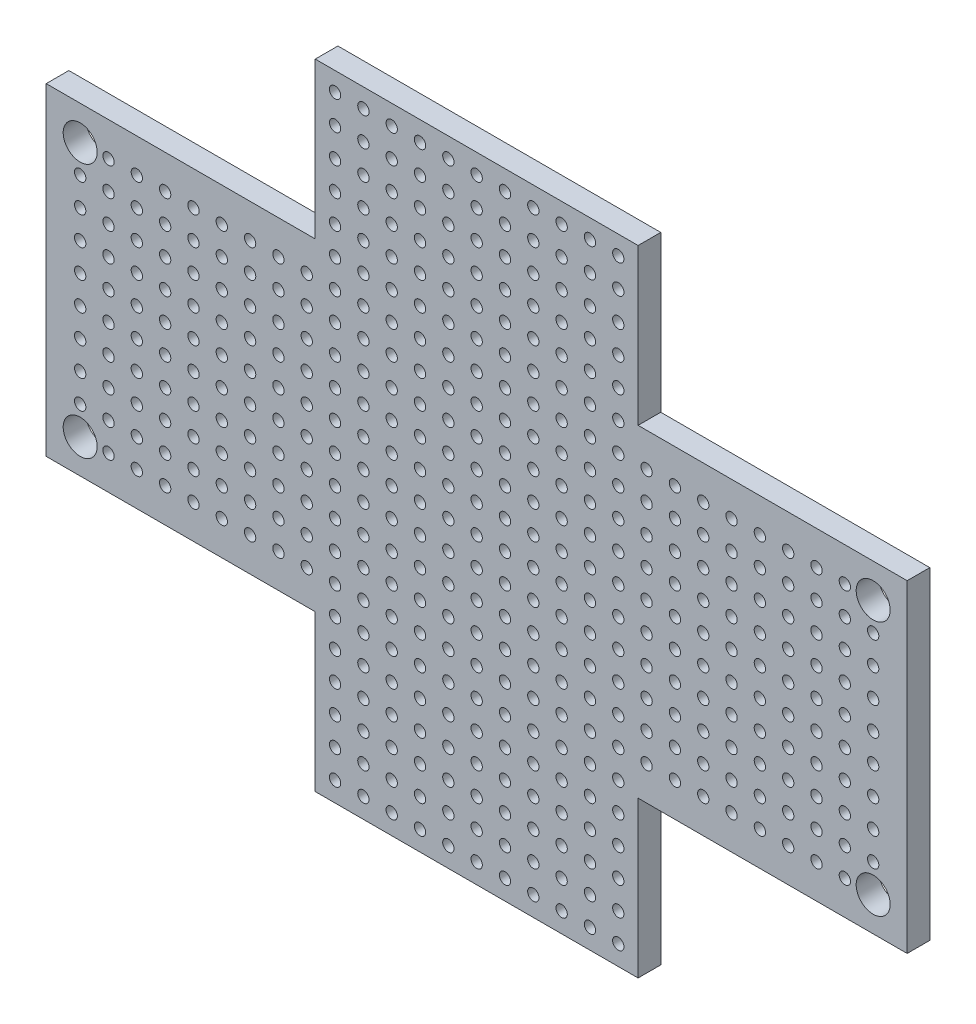
from build123d import *

# Parameters (mm, degrees)
SKETCH1_R           = 1.5
SKETCH1_R_2         = 0.5
BOSS_EXTRUDE1_DEPTH = 2


with BuildPart() as part:
    # Sketch1 → Boss-Extrude1 (new body)
    with BuildSketch(Plane.XY):
        Polygon((0, 0), (23.75, 0), (23.75, -13.75), (52.25, -13.75), (52.25, 0), (76, 0), (76, 28.5), (52.25, 28.5), (52.25, 42.25), (23.75, 42.25), (23.75, 28.5), (0, 28.5), align=None)
        with Locations((3, 25.5)):
            Circle(SKETCH1_R, mode=Mode.SUBTRACT)
        with Locations((73, 25.5)):
            Circle(SKETCH1_R, mode=Mode.SUBTRACT)
        with Locations((3, 3)):
            Circle(SKETCH1_R, mode=Mode.SUBTRACT)
        with Locations((73, 3)):
            Circle(SKETCH1_R, mode=Mode.SUBTRACT)
        with Locations((28, 38.04)):
            Circle(SKETCH1_R_2, mode=Mode.SUBTRACT)
        with Locations((5.5, 3)):
            Circle(SKETCH1_R_2, mode=Mode.SUBTRACT)
        with Locations((8, 3)):
            Circle(SKETCH1_R_2, mode=Mode.SUBTRACT)
        with Locations((10.5, 3)):
            Circle(SKETCH1_R_2, mode=Mode.SUBTRACT)
        with Locations((13, 3)):
            Circle(SKETCH1_R_2, mode=Mode.SUBTRACT)
        with Locations((15.5, 3)):
            Circle(SKETCH1_R_2, mode=Mode.SUBTRACT)
        with Locations((18, 3)):
            Circle(SKETCH1_R_2, mode=Mode.SUBTRACT)
        with Locations((20.5, 3)):
            Circle(SKETCH1_R_2, mode=Mode.SUBTRACT)
        with Locations((23, 3)):
            Circle(SKETCH1_R_2, mode=Mode.SUBTRACT)
        with Locations((25.5, 3)):
            Circle(SKETCH1_R_2, mode=Mode.SUBTRACT)
        with Locations((28, 3)):
            Circle(SKETCH1_R_2, mode=Mode.SUBTRACT)
        with Locations((30.5, 3)):
            Circle(SKETCH1_R_2, mode=Mode.SUBTRACT)
        with Locations((33, 3)):
            Circle(SKETCH1_R_2, mode=Mode.SUBTRACT)
        with Locations((35.5, 3)):
            Circle(SKETCH1_R_2, mode=Mode.SUBTRACT)
        with Locations((38, 3)):
            Circle(SKETCH1_R_2, mode=Mode.SUBTRACT)
        with Locations((40.5, 3)):
            Circle(SKETCH1_R_2, mode=Mode.SUBTRACT)
        with Locations((43, 3)):
            Circle(SKETCH1_R_2, mode=Mode.SUBTRACT)
        with Locations((45.5, 3)):
            Circle(SKETCH1_R_2, mode=Mode.SUBTRACT)
        with Locations((48, 3)):
            Circle(SKETCH1_R_2, mode=Mode.SUBTRACT)
        with Locations((50.5, 3)):
            Circle(SKETCH1_R_2, mode=Mode.SUBTRACT)
        with Locations((53, 3)):
            Circle(SKETCH1_R_2, mode=Mode.SUBTRACT)
        with Locations((55.5, 3)):
            Circle(SKETCH1_R_2, mode=Mode.SUBTRACT)
        with Locations((58, 3)):
            Circle(SKETCH1_R_2, mode=Mode.SUBTRACT)
        with Locations((60.5, 3)):
            Circle(SKETCH1_R_2, mode=Mode.SUBTRACT)
        with Locations((63, 3)):
            Circle(SKETCH1_R_2, mode=Mode.SUBTRACT)
        with Locations((65.5, 3)):
            Circle(SKETCH1_R_2, mode=Mode.SUBTRACT)
        with Locations((68, 3)):
            Circle(SKETCH1_R_2, mode=Mode.SUBTRACT)
        with Locations((70.5, 3)):
            Circle(SKETCH1_R_2, mode=Mode.SUBTRACT)
        with Locations((25.5, 38.04)):
            Circle(SKETCH1_R_2, mode=Mode.SUBTRACT)
        with Locations((5.5, 5.5)):
            Circle(SKETCH1_R_2, mode=Mode.SUBTRACT)
        with Locations((8, 5.5)):
            Circle(SKETCH1_R_2, mode=Mode.SUBTRACT)
        with Locations((10.5, 5.5)):
            Circle(SKETCH1_R_2, mode=Mode.SUBTRACT)
        with Locations((13, 5.5)):
            Circle(SKETCH1_R_2, mode=Mode.SUBTRACT)
        with Locations((15.5, 5.5)):
            Circle(SKETCH1_R_2, mode=Mode.SUBTRACT)
        with Locations((18, 5.5)):
            Circle(SKETCH1_R_2, mode=Mode.SUBTRACT)
        with Locations((20.5, 5.5)):
            Circle(SKETCH1_R_2, mode=Mode.SUBTRACT)
        with Locations((23, 5.5)):
            Circle(SKETCH1_R_2, mode=Mode.SUBTRACT)
        with Locations((25.5, 5.5)):
            Circle(SKETCH1_R_2, mode=Mode.SUBTRACT)
        with Locations((28, 5.5)):
            Circle(SKETCH1_R_2, mode=Mode.SUBTRACT)
        with Locations((30.5, 5.5)):
            Circle(SKETCH1_R_2, mode=Mode.SUBTRACT)
        with Locations((33, 5.5)):
            Circle(SKETCH1_R_2, mode=Mode.SUBTRACT)
        with Locations((35.5, 5.5)):
            Circle(SKETCH1_R_2, mode=Mode.SUBTRACT)
        with Locations((38, 5.5)):
            Circle(SKETCH1_R_2, mode=Mode.SUBTRACT)
        with Locations((40.5, 5.5)):
            Circle(SKETCH1_R_2, mode=Mode.SUBTRACT)
        with Locations((43, 5.5)):
            Circle(SKETCH1_R_2, mode=Mode.SUBTRACT)
        with Locations((45.5, 5.5)):
            Circle(SKETCH1_R_2, mode=Mode.SUBTRACT)
        with Locations((48, 5.5)):
            Circle(SKETCH1_R_2, mode=Mode.SUBTRACT)
        with Locations((50.5, 5.5)):
            Circle(SKETCH1_R_2, mode=Mode.SUBTRACT)
        with Locations((53, 5.5)):
            Circle(SKETCH1_R_2, mode=Mode.SUBTRACT)
        with Locations((55.5, 5.5)):
            Circle(SKETCH1_R_2, mode=Mode.SUBTRACT)
        with Locations((58, 5.5)):
            Circle(SKETCH1_R_2, mode=Mode.SUBTRACT)
        with Locations((60.5, 5.5)):
            Circle(SKETCH1_R_2, mode=Mode.SUBTRACT)
        with Locations((63, 5.5)):
            Circle(SKETCH1_R_2, mode=Mode.SUBTRACT)
        with Locations((65.5, 5.5)):
            Circle(SKETCH1_R_2, mode=Mode.SUBTRACT)
        with Locations((68, 5.5)):
            Circle(SKETCH1_R_2, mode=Mode.SUBTRACT)
        with Locations((70.5, 5.5)):
            Circle(SKETCH1_R_2, mode=Mode.SUBTRACT)
        with Locations((73, 5.5)):
            Circle(SKETCH1_R_2, mode=Mode.SUBTRACT)
        with Locations((5.5, 8)):
            Circle(SKETCH1_R_2, mode=Mode.SUBTRACT)
        with Locations((8, 8)):
            Circle(SKETCH1_R_2, mode=Mode.SUBTRACT)
        with Locations((10.5, 8)):
            Circle(SKETCH1_R_2, mode=Mode.SUBTRACT)
        with Locations((13, 8)):
            Circle(SKETCH1_R_2, mode=Mode.SUBTRACT)
        with Locations((15.5, 8)):
            Circle(SKETCH1_R_2, mode=Mode.SUBTRACT)
        with Locations((18, 8)):
            Circle(SKETCH1_R_2, mode=Mode.SUBTRACT)
        with Locations((20.5, 8)):
            Circle(SKETCH1_R_2, mode=Mode.SUBTRACT)
        with Locations((23, 8)):
            Circle(SKETCH1_R_2, mode=Mode.SUBTRACT)
        with Locations((25.5, 8)):
            Circle(SKETCH1_R_2, mode=Mode.SUBTRACT)
        with Locations((28, 8)):
            Circle(SKETCH1_R_2, mode=Mode.SUBTRACT)
        with Locations((30.5, 8)):
            Circle(SKETCH1_R_2, mode=Mode.SUBTRACT)
        with Locations((33, 8)):
            Circle(SKETCH1_R_2, mode=Mode.SUBTRACT)
        with Locations((35.5, 8)):
            Circle(SKETCH1_R_2, mode=Mode.SUBTRACT)
        with Locations((38, 8)):
            Circle(SKETCH1_R_2, mode=Mode.SUBTRACT)
        with Locations((40.5, 8)):
            Circle(SKETCH1_R_2, mode=Mode.SUBTRACT)
        with Locations((43, 8)):
            Circle(SKETCH1_R_2, mode=Mode.SUBTRACT)
        with Locations((45.5, 8)):
            Circle(SKETCH1_R_2, mode=Mode.SUBTRACT)
        with Locations((48, 8)):
            Circle(SKETCH1_R_2, mode=Mode.SUBTRACT)
        with Locations((50.5, 8)):
            Circle(SKETCH1_R_2, mode=Mode.SUBTRACT)
        with Locations((53, 8)):
            Circle(SKETCH1_R_2, mode=Mode.SUBTRACT)
        with Locations((55.5, 8)):
            Circle(SKETCH1_R_2, mode=Mode.SUBTRACT)
        with Locations((58, 8)):
            Circle(SKETCH1_R_2, mode=Mode.SUBTRACT)
        with Locations((60.5, 8)):
            Circle(SKETCH1_R_2, mode=Mode.SUBTRACT)
        with Locations((63, 8)):
            Circle(SKETCH1_R_2, mode=Mode.SUBTRACT)
        with Locations((65.5, 8)):
            Circle(SKETCH1_R_2, mode=Mode.SUBTRACT)
        with Locations((68, 8)):
            Circle(SKETCH1_R_2, mode=Mode.SUBTRACT)
        with Locations((70.5, 8)):
            Circle(SKETCH1_R_2, mode=Mode.SUBTRACT)
        with Locations((73, 8)):
            Circle(SKETCH1_R_2, mode=Mode.SUBTRACT)
        with Locations((5.5, 10.5)):
            Circle(SKETCH1_R_2, mode=Mode.SUBTRACT)
        with Locations((8, 10.5)):
            Circle(SKETCH1_R_2, mode=Mode.SUBTRACT)
        with Locations((10.5, 10.5)):
            Circle(SKETCH1_R_2, mode=Mode.SUBTRACT)
        with Locations((13, 10.5)):
            Circle(SKETCH1_R_2, mode=Mode.SUBTRACT)
        with Locations((15.5, 10.5)):
            Circle(SKETCH1_R_2, mode=Mode.SUBTRACT)
        with Locations((18, 10.5)):
            Circle(SKETCH1_R_2, mode=Mode.SUBTRACT)
        with Locations((20.5, 10.5)):
            Circle(SKETCH1_R_2, mode=Mode.SUBTRACT)
        with Locations((23, 10.5)):
            Circle(SKETCH1_R_2, mode=Mode.SUBTRACT)
        with Locations((25.5, 10.5)):
            Circle(SKETCH1_R_2, mode=Mode.SUBTRACT)
        with Locations((28, 10.5)):
            Circle(SKETCH1_R_2, mode=Mode.SUBTRACT)
        with Locations((30.5, 10.5)):
            Circle(SKETCH1_R_2, mode=Mode.SUBTRACT)
        with Locations((33, 10.5)):
            Circle(SKETCH1_R_2, mode=Mode.SUBTRACT)
        with Locations((35.5, 10.5)):
            Circle(SKETCH1_R_2, mode=Mode.SUBTRACT)
        with Locations((38, 10.5)):
            Circle(SKETCH1_R_2, mode=Mode.SUBTRACT)
        with Locations((40.5, 10.5)):
            Circle(SKETCH1_R_2, mode=Mode.SUBTRACT)
        with Locations((43, 10.5)):
            Circle(SKETCH1_R_2, mode=Mode.SUBTRACT)
        with Locations((45.5, 10.5)):
            Circle(SKETCH1_R_2, mode=Mode.SUBTRACT)
        with Locations((48, 10.5)):
            Circle(SKETCH1_R_2, mode=Mode.SUBTRACT)
        with Locations((50.5, 10.5)):
            Circle(SKETCH1_R_2, mode=Mode.SUBTRACT)
        with Locations((53, 10.5)):
            Circle(SKETCH1_R_2, mode=Mode.SUBTRACT)
        with Locations((55.5, 10.5)):
            Circle(SKETCH1_R_2, mode=Mode.SUBTRACT)
        with Locations((58, 10.5)):
            Circle(SKETCH1_R_2, mode=Mode.SUBTRACT)
        with Locations((60.5, 10.5)):
            Circle(SKETCH1_R_2, mode=Mode.SUBTRACT)
        with Locations((63, 10.5)):
            Circle(SKETCH1_R_2, mode=Mode.SUBTRACT)
        with Locations((65.5, 10.5)):
            Circle(SKETCH1_R_2, mode=Mode.SUBTRACT)
        with Locations((68, 10.5)):
            Circle(SKETCH1_R_2, mode=Mode.SUBTRACT)
        with Locations((70.5, 10.5)):
            Circle(SKETCH1_R_2, mode=Mode.SUBTRACT)
        with Locations((73, 10.5)):
            Circle(SKETCH1_R_2, mode=Mode.SUBTRACT)
        with Locations((5.5, 13)):
            Circle(SKETCH1_R_2, mode=Mode.SUBTRACT)
        with Locations((8, 13)):
            Circle(SKETCH1_R_2, mode=Mode.SUBTRACT)
        with Locations((10.5, 13)):
            Circle(SKETCH1_R_2, mode=Mode.SUBTRACT)
        with Locations((13, 13)):
            Circle(SKETCH1_R_2, mode=Mode.SUBTRACT)
        with Locations((15.5, 13)):
            Circle(SKETCH1_R_2, mode=Mode.SUBTRACT)
        with Locations((18, 13)):
            Circle(SKETCH1_R_2, mode=Mode.SUBTRACT)
        with Locations((20.5, 13)):
            Circle(SKETCH1_R_2, mode=Mode.SUBTRACT)
        with Locations((23, 13)):
            Circle(SKETCH1_R_2, mode=Mode.SUBTRACT)
        with Locations((25.5, 13)):
            Circle(SKETCH1_R_2, mode=Mode.SUBTRACT)
        with Locations((28, 13)):
            Circle(SKETCH1_R_2, mode=Mode.SUBTRACT)
        with Locations((30.5, 13)):
            Circle(SKETCH1_R_2, mode=Mode.SUBTRACT)
        with Locations((33, 13)):
            Circle(SKETCH1_R_2, mode=Mode.SUBTRACT)
        with Locations((35.5, 13)):
            Circle(SKETCH1_R_2, mode=Mode.SUBTRACT)
        with Locations((38, 13)):
            Circle(SKETCH1_R_2, mode=Mode.SUBTRACT)
        with Locations((40.5, 13)):
            Circle(SKETCH1_R_2, mode=Mode.SUBTRACT)
        with Locations((43, 13)):
            Circle(SKETCH1_R_2, mode=Mode.SUBTRACT)
        with Locations((45.5, 13)):
            Circle(SKETCH1_R_2, mode=Mode.SUBTRACT)
        with Locations((48, 13)):
            Circle(SKETCH1_R_2, mode=Mode.SUBTRACT)
        with Locations((50.5, 13)):
            Circle(SKETCH1_R_2, mode=Mode.SUBTRACT)
        with Locations((53, 13)):
            Circle(SKETCH1_R_2, mode=Mode.SUBTRACT)
        with Locations((55.5, 13)):
            Circle(SKETCH1_R_2, mode=Mode.SUBTRACT)
        with Locations((58, 13)):
            Circle(SKETCH1_R_2, mode=Mode.SUBTRACT)
        with Locations((60.5, 13)):
            Circle(SKETCH1_R_2, mode=Mode.SUBTRACT)
        with Locations((63, 13)):
            Circle(SKETCH1_R_2, mode=Mode.SUBTRACT)
        with Locations((65.5, 13)):
            Circle(SKETCH1_R_2, mode=Mode.SUBTRACT)
        with Locations((68, 13)):
            Circle(SKETCH1_R_2, mode=Mode.SUBTRACT)
        with Locations((70.5, 13)):
            Circle(SKETCH1_R_2, mode=Mode.SUBTRACT)
        with Locations((73, 13)):
            Circle(SKETCH1_R_2, mode=Mode.SUBTRACT)
        with Locations((5.5, 15.5)):
            Circle(SKETCH1_R_2, mode=Mode.SUBTRACT)
        with Locations((8, 15.5)):
            Circle(SKETCH1_R_2, mode=Mode.SUBTRACT)
        with Locations((10.5, 15.5)):
            Circle(SKETCH1_R_2, mode=Mode.SUBTRACT)
        with Locations((13, 15.5)):
            Circle(SKETCH1_R_2, mode=Mode.SUBTRACT)
        with Locations((15.5, 15.5)):
            Circle(SKETCH1_R_2, mode=Mode.SUBTRACT)
        with Locations((18, 15.5)):
            Circle(SKETCH1_R_2, mode=Mode.SUBTRACT)
        with Locations((20.5, 15.5)):
            Circle(SKETCH1_R_2, mode=Mode.SUBTRACT)
        with Locations((23, 15.5)):
            Circle(SKETCH1_R_2, mode=Mode.SUBTRACT)
        with Locations((25.5, 15.5)):
            Circle(SKETCH1_R_2, mode=Mode.SUBTRACT)
        with Locations((28, 15.5)):
            Circle(SKETCH1_R_2, mode=Mode.SUBTRACT)
        with Locations((30.5, 15.5)):
            Circle(SKETCH1_R_2, mode=Mode.SUBTRACT)
        with Locations((33, 15.5)):
            Circle(SKETCH1_R_2, mode=Mode.SUBTRACT)
        with Locations((35.5, 15.5)):
            Circle(SKETCH1_R_2, mode=Mode.SUBTRACT)
        with Locations((38, 15.5)):
            Circle(SKETCH1_R_2, mode=Mode.SUBTRACT)
        with Locations((40.5, 15.5)):
            Circle(SKETCH1_R_2, mode=Mode.SUBTRACT)
        with Locations((43, 15.5)):
            Circle(SKETCH1_R_2, mode=Mode.SUBTRACT)
        with Locations((45.5, 15.5)):
            Circle(SKETCH1_R_2, mode=Mode.SUBTRACT)
        with Locations((48, 15.5)):
            Circle(SKETCH1_R_2, mode=Mode.SUBTRACT)
        with Locations((50.5, 15.5)):
            Circle(SKETCH1_R_2, mode=Mode.SUBTRACT)
        with Locations((53, 15.5)):
            Circle(SKETCH1_R_2, mode=Mode.SUBTRACT)
        with Locations((55.5, 15.5)):
            Circle(SKETCH1_R_2, mode=Mode.SUBTRACT)
        with Locations((58, 15.5)):
            Circle(SKETCH1_R_2, mode=Mode.SUBTRACT)
        with Locations((60.5, 15.5)):
            Circle(SKETCH1_R_2, mode=Mode.SUBTRACT)
        with Locations((63, 15.5)):
            Circle(SKETCH1_R_2, mode=Mode.SUBTRACT)
        with Locations((65.5, 15.5)):
            Circle(SKETCH1_R_2, mode=Mode.SUBTRACT)
        with Locations((68, 15.5)):
            Circle(SKETCH1_R_2, mode=Mode.SUBTRACT)
        with Locations((70.5, 15.5)):
            Circle(SKETCH1_R_2, mode=Mode.SUBTRACT)
        with Locations((73, 15.5)):
            Circle(SKETCH1_R_2, mode=Mode.SUBTRACT)
        with Locations((5.5, 18)):
            Circle(SKETCH1_R_2, mode=Mode.SUBTRACT)
        with Locations((8, 18)):
            Circle(SKETCH1_R_2, mode=Mode.SUBTRACT)
        with Locations((10.5, 18)):
            Circle(SKETCH1_R_2, mode=Mode.SUBTRACT)
        with Locations((13, 18)):
            Circle(SKETCH1_R_2, mode=Mode.SUBTRACT)
        with Locations((15.5, 18)):
            Circle(SKETCH1_R_2, mode=Mode.SUBTRACT)
        with Locations((18, 18)):
            Circle(SKETCH1_R_2, mode=Mode.SUBTRACT)
        with Locations((20.5, 18)):
            Circle(SKETCH1_R_2, mode=Mode.SUBTRACT)
        with Locations((23, 18)):
            Circle(SKETCH1_R_2, mode=Mode.SUBTRACT)
        with Locations((25.5, 18)):
            Circle(SKETCH1_R_2, mode=Mode.SUBTRACT)
        with Locations((28, 18)):
            Circle(SKETCH1_R_2, mode=Mode.SUBTRACT)
        with Locations((30.5, 18)):
            Circle(SKETCH1_R_2, mode=Mode.SUBTRACT)
        with Locations((33, 18)):
            Circle(SKETCH1_R_2, mode=Mode.SUBTRACT)
        with Locations((35.5, 18)):
            Circle(SKETCH1_R_2, mode=Mode.SUBTRACT)
        with Locations((38, 18)):
            Circle(SKETCH1_R_2, mode=Mode.SUBTRACT)
        with Locations((40.5, 18)):
            Circle(SKETCH1_R_2, mode=Mode.SUBTRACT)
        with Locations((43, 18)):
            Circle(SKETCH1_R_2, mode=Mode.SUBTRACT)
        with Locations((45.5, 18)):
            Circle(SKETCH1_R_2, mode=Mode.SUBTRACT)
        with Locations((48, 18)):
            Circle(SKETCH1_R_2, mode=Mode.SUBTRACT)
        with Locations((50.5, 18)):
            Circle(SKETCH1_R_2, mode=Mode.SUBTRACT)
        with Locations((53, 18)):
            Circle(SKETCH1_R_2, mode=Mode.SUBTRACT)
        with Locations((55.5, 18)):
            Circle(SKETCH1_R_2, mode=Mode.SUBTRACT)
        with Locations((58, 18)):
            Circle(SKETCH1_R_2, mode=Mode.SUBTRACT)
        with Locations((60.5, 18)):
            Circle(SKETCH1_R_2, mode=Mode.SUBTRACT)
        with Locations((63, 18)):
            Circle(SKETCH1_R_2, mode=Mode.SUBTRACT)
        with Locations((65.5, 18)):
            Circle(SKETCH1_R_2, mode=Mode.SUBTRACT)
        with Locations((68, 18)):
            Circle(SKETCH1_R_2, mode=Mode.SUBTRACT)
        with Locations((70.5, 18)):
            Circle(SKETCH1_R_2, mode=Mode.SUBTRACT)
        with Locations((73, 18)):
            Circle(SKETCH1_R_2, mode=Mode.SUBTRACT)
        with Locations((5.5, 20.5)):
            Circle(SKETCH1_R_2, mode=Mode.SUBTRACT)
        with Locations((8, 20.5)):
            Circle(SKETCH1_R_2, mode=Mode.SUBTRACT)
        with Locations((10.5, 20.5)):
            Circle(SKETCH1_R_2, mode=Mode.SUBTRACT)
        with Locations((13, 20.5)):
            Circle(SKETCH1_R_2, mode=Mode.SUBTRACT)
        with Locations((15.5, 20.5)):
            Circle(SKETCH1_R_2, mode=Mode.SUBTRACT)
        with Locations((18, 20.5)):
            Circle(SKETCH1_R_2, mode=Mode.SUBTRACT)
        with Locations((20.5, 20.5)):
            Circle(SKETCH1_R_2, mode=Mode.SUBTRACT)
        with Locations((23, 20.5)):
            Circle(SKETCH1_R_2, mode=Mode.SUBTRACT)
        with Locations((25.5, 20.5)):
            Circle(SKETCH1_R_2, mode=Mode.SUBTRACT)
        with Locations((28, 20.5)):
            Circle(SKETCH1_R_2, mode=Mode.SUBTRACT)
        with Locations((30.5, 20.5)):
            Circle(SKETCH1_R_2, mode=Mode.SUBTRACT)
        with Locations((33, 20.5)):
            Circle(SKETCH1_R_2, mode=Mode.SUBTRACT)
        with Locations((35.5, 20.5)):
            Circle(SKETCH1_R_2, mode=Mode.SUBTRACT)
        with Locations((38, 20.5)):
            Circle(SKETCH1_R_2, mode=Mode.SUBTRACT)
        with Locations((40.5, 20.5)):
            Circle(SKETCH1_R_2, mode=Mode.SUBTRACT)
        with Locations((43, 20.5)):
            Circle(SKETCH1_R_2, mode=Mode.SUBTRACT)
        with Locations((45.5, 20.5)):
            Circle(SKETCH1_R_2, mode=Mode.SUBTRACT)
        with Locations((48, 20.5)):
            Circle(SKETCH1_R_2, mode=Mode.SUBTRACT)
        with Locations((50.5, 20.5)):
            Circle(SKETCH1_R_2, mode=Mode.SUBTRACT)
        with Locations((53, 20.5)):
            Circle(SKETCH1_R_2, mode=Mode.SUBTRACT)
        with Locations((55.5, 20.5)):
            Circle(SKETCH1_R_2, mode=Mode.SUBTRACT)
        with Locations((58, 20.5)):
            Circle(SKETCH1_R_2, mode=Mode.SUBTRACT)
        with Locations((60.5, 20.5)):
            Circle(SKETCH1_R_2, mode=Mode.SUBTRACT)
        with Locations((63, 20.5)):
            Circle(SKETCH1_R_2, mode=Mode.SUBTRACT)
        with Locations((65.5, 20.5)):
            Circle(SKETCH1_R_2, mode=Mode.SUBTRACT)
        with Locations((68, 20.5)):
            Circle(SKETCH1_R_2, mode=Mode.SUBTRACT)
        with Locations((70.5, 20.5)):
            Circle(SKETCH1_R_2, mode=Mode.SUBTRACT)
        with Locations((73, 20.5)):
            Circle(SKETCH1_R_2, mode=Mode.SUBTRACT)
        with Locations((5.5, 23)):
            Circle(SKETCH1_R_2, mode=Mode.SUBTRACT)
        with Locations((8, 23)):
            Circle(SKETCH1_R_2, mode=Mode.SUBTRACT)
        with Locations((10.5, 23)):
            Circle(SKETCH1_R_2, mode=Mode.SUBTRACT)
        with Locations((13, 23)):
            Circle(SKETCH1_R_2, mode=Mode.SUBTRACT)
        with Locations((15.5, 23)):
            Circle(SKETCH1_R_2, mode=Mode.SUBTRACT)
        with Locations((18, 23)):
            Circle(SKETCH1_R_2, mode=Mode.SUBTRACT)
        with Locations((20.5, 23)):
            Circle(SKETCH1_R_2, mode=Mode.SUBTRACT)
        with Locations((23, 23)):
            Circle(SKETCH1_R_2, mode=Mode.SUBTRACT)
        with Locations((25.5, 23)):
            Circle(SKETCH1_R_2, mode=Mode.SUBTRACT)
        with Locations((28, 23)):
            Circle(SKETCH1_R_2, mode=Mode.SUBTRACT)
        with Locations((30.5, 23)):
            Circle(SKETCH1_R_2, mode=Mode.SUBTRACT)
        with Locations((33, 23)):
            Circle(SKETCH1_R_2, mode=Mode.SUBTRACT)
        with Locations((35.5, 23)):
            Circle(SKETCH1_R_2, mode=Mode.SUBTRACT)
        with Locations((38, 23)):
            Circle(SKETCH1_R_2, mode=Mode.SUBTRACT)
        with Locations((40.5, 23)):
            Circle(SKETCH1_R_2, mode=Mode.SUBTRACT)
        with Locations((43, 23)):
            Circle(SKETCH1_R_2, mode=Mode.SUBTRACT)
        with Locations((45.5, 23)):
            Circle(SKETCH1_R_2, mode=Mode.SUBTRACT)
        with Locations((48, 23)):
            Circle(SKETCH1_R_2, mode=Mode.SUBTRACT)
        with Locations((50.5, 23)):
            Circle(SKETCH1_R_2, mode=Mode.SUBTRACT)
        with Locations((53, 23)):
            Circle(SKETCH1_R_2, mode=Mode.SUBTRACT)
        with Locations((55.5, 23)):
            Circle(SKETCH1_R_2, mode=Mode.SUBTRACT)
        with Locations((58, 23)):
            Circle(SKETCH1_R_2, mode=Mode.SUBTRACT)
        with Locations((60.5, 23)):
            Circle(SKETCH1_R_2, mode=Mode.SUBTRACT)
        with Locations((63, 23)):
            Circle(SKETCH1_R_2, mode=Mode.SUBTRACT)
        with Locations((65.5, 23)):
            Circle(SKETCH1_R_2, mode=Mode.SUBTRACT)
        with Locations((68, 23)):
            Circle(SKETCH1_R_2, mode=Mode.SUBTRACT)
        with Locations((70.5, 23)):
            Circle(SKETCH1_R_2, mode=Mode.SUBTRACT)
        with Locations((73, 23)):
            Circle(SKETCH1_R_2, mode=Mode.SUBTRACT)
        with Locations((5.5, 25.5)):
            Circle(SKETCH1_R_2, mode=Mode.SUBTRACT)
        with Locations((8, 25.5)):
            Circle(SKETCH1_R_2, mode=Mode.SUBTRACT)
        with Locations((10.5, 25.5)):
            Circle(SKETCH1_R_2, mode=Mode.SUBTRACT)
        with Locations((13, 25.5)):
            Circle(SKETCH1_R_2, mode=Mode.SUBTRACT)
        with Locations((15.5, 25.5)):
            Circle(SKETCH1_R_2, mode=Mode.SUBTRACT)
        with Locations((18, 25.5)):
            Circle(SKETCH1_R_2, mode=Mode.SUBTRACT)
        with Locations((20.5, 25.5)):
            Circle(SKETCH1_R_2, mode=Mode.SUBTRACT)
        with Locations((23, 25.5)):
            Circle(SKETCH1_R_2, mode=Mode.SUBTRACT)
        with Locations((25.5, 25.5)):
            Circle(SKETCH1_R_2, mode=Mode.SUBTRACT)
        with Locations((28, 25.5)):
            Circle(SKETCH1_R_2, mode=Mode.SUBTRACT)
        with Locations((30.5, 25.5)):
            Circle(SKETCH1_R_2, mode=Mode.SUBTRACT)
        with Locations((33, 25.5)):
            Circle(SKETCH1_R_2, mode=Mode.SUBTRACT)
        with Locations((35.5, 25.5)):
            Circle(SKETCH1_R_2, mode=Mode.SUBTRACT)
        with Locations((38, 25.5)):
            Circle(SKETCH1_R_2, mode=Mode.SUBTRACT)
        with Locations((40.5, 25.5)):
            Circle(SKETCH1_R_2, mode=Mode.SUBTRACT)
        with Locations((43, 25.5)):
            Circle(SKETCH1_R_2, mode=Mode.SUBTRACT)
        with Locations((45.5, 25.5)):
            Circle(SKETCH1_R_2, mode=Mode.SUBTRACT)
        with Locations((48, 25.5)):
            Circle(SKETCH1_R_2, mode=Mode.SUBTRACT)
        with Locations((50.5, 25.5)):
            Circle(SKETCH1_R_2, mode=Mode.SUBTRACT)
        with Locations((53, 25.5)):
            Circle(SKETCH1_R_2, mode=Mode.SUBTRACT)
        with Locations((55.5, 25.5)):
            Circle(SKETCH1_R_2, mode=Mode.SUBTRACT)
        with Locations((58, 25.5)):
            Circle(SKETCH1_R_2, mode=Mode.SUBTRACT)
        with Locations((60.5, 25.5)):
            Circle(SKETCH1_R_2, mode=Mode.SUBTRACT)
        with Locations((63, 25.5)):
            Circle(SKETCH1_R_2, mode=Mode.SUBTRACT)
        with Locations((65.5, 25.5)):
            Circle(SKETCH1_R_2, mode=Mode.SUBTRACT)
        with Locations((68, 25.5)):
            Circle(SKETCH1_R_2, mode=Mode.SUBTRACT)
        with Locations((70.5, 25.5)):
            Circle(SKETCH1_R_2, mode=Mode.SUBTRACT)
        with Locations((28, 40.58)):
            Circle(SKETCH1_R_2, mode=Mode.SUBTRACT)
        with Locations((3, 5.5)):
            Circle(SKETCH1_R_2, mode=Mode.SUBTRACT)
        with Locations((3, 8)):
            Circle(SKETCH1_R_2, mode=Mode.SUBTRACT)
        with Locations((3, 10.5)):
            Circle(SKETCH1_R_2, mode=Mode.SUBTRACT)
        with Locations((3, 13)):
            Circle(SKETCH1_R_2, mode=Mode.SUBTRACT)
        with Locations((3, 15.5)):
            Circle(SKETCH1_R_2, mode=Mode.SUBTRACT)
        with Locations((3, 18)):
            Circle(SKETCH1_R_2, mode=Mode.SUBTRACT)
        with Locations((3, 20.5)):
            Circle(SKETCH1_R_2, mode=Mode.SUBTRACT)
        with Locations((3, 23)):
            Circle(SKETCH1_R_2, mode=Mode.SUBTRACT)
        with Locations((25.5, 40.58)):
            Circle(SKETCH1_R_2, mode=Mode.SUBTRACT)
        with Locations((25.5, 28)):
            Circle(SKETCH1_R_2, mode=Mode.SUBTRACT)
        with Locations((28, 28)):
            Circle(SKETCH1_R_2, mode=Mode.SUBTRACT)
        with Locations((30.5, 28)):
            Circle(SKETCH1_R_2, mode=Mode.SUBTRACT)
        with Locations((33, 28)):
            Circle(SKETCH1_R_2, mode=Mode.SUBTRACT)
        with Locations((35.5, 28)):
            Circle(SKETCH1_R_2, mode=Mode.SUBTRACT)
        with Locations((38, 28)):
            Circle(SKETCH1_R_2, mode=Mode.SUBTRACT)
        with Locations((40.5, 28)):
            Circle(SKETCH1_R_2, mode=Mode.SUBTRACT)
        with Locations((43, 28)):
            Circle(SKETCH1_R_2, mode=Mode.SUBTRACT)
        with Locations((45.5, 28)):
            Circle(SKETCH1_R_2, mode=Mode.SUBTRACT)
        with Locations((48, 28)):
            Circle(SKETCH1_R_2, mode=Mode.SUBTRACT)
        with Locations((50.5, 28)):
            Circle(SKETCH1_R_2, mode=Mode.SUBTRACT)
        with Locations((25.5, 30.5)):
            Circle(SKETCH1_R_2, mode=Mode.SUBTRACT)
        with Locations((28, 30.5)):
            Circle(SKETCH1_R_2, mode=Mode.SUBTRACT)
        with Locations((30.5, 30.5)):
            Circle(SKETCH1_R_2, mode=Mode.SUBTRACT)
        with Locations((33, 30.5)):
            Circle(SKETCH1_R_2, mode=Mode.SUBTRACT)
        with Locations((35.5, 30.5)):
            Circle(SKETCH1_R_2, mode=Mode.SUBTRACT)
        with Locations((38, 30.5)):
            Circle(SKETCH1_R_2, mode=Mode.SUBTRACT)
        with Locations((40.5, 30.5)):
            Circle(SKETCH1_R_2, mode=Mode.SUBTRACT)
        with Locations((43, 30.5)):
            Circle(SKETCH1_R_2, mode=Mode.SUBTRACT)
        with Locations((45.5, 30.5)):
            Circle(SKETCH1_R_2, mode=Mode.SUBTRACT)
        with Locations((48, 30.5)):
            Circle(SKETCH1_R_2, mode=Mode.SUBTRACT)
        with Locations((50.5, 30.5)):
            Circle(SKETCH1_R_2, mode=Mode.SUBTRACT)
        with Locations((25.5, 33)):
            Circle(SKETCH1_R_2, mode=Mode.SUBTRACT)
        with Locations((28, 33)):
            Circle(SKETCH1_R_2, mode=Mode.SUBTRACT)
        with Locations((30.5, 33)):
            Circle(SKETCH1_R_2, mode=Mode.SUBTRACT)
        with Locations((33, 33)):
            Circle(SKETCH1_R_2, mode=Mode.SUBTRACT)
        with Locations((35.5, 33)):
            Circle(SKETCH1_R_2, mode=Mode.SUBTRACT)
        with Locations((38, 33)):
            Circle(SKETCH1_R_2, mode=Mode.SUBTRACT)
        with Locations((40.5, 33)):
            Circle(SKETCH1_R_2, mode=Mode.SUBTRACT)
        with Locations((43, 33)):
            Circle(SKETCH1_R_2, mode=Mode.SUBTRACT)
        with Locations((45.5, 33)):
            Circle(SKETCH1_R_2, mode=Mode.SUBTRACT)
        with Locations((48, 33)):
            Circle(SKETCH1_R_2, mode=Mode.SUBTRACT)
        with Locations((50.5, 33)):
            Circle(SKETCH1_R_2, mode=Mode.SUBTRACT)
        with Locations((25.5, 35.5)):
            Circle(SKETCH1_R_2, mode=Mode.SUBTRACT)
        with Locations((28, 35.5)):
            Circle(SKETCH1_R_2, mode=Mode.SUBTRACT)
        with Locations((30.5, 35.5)):
            Circle(SKETCH1_R_2, mode=Mode.SUBTRACT)
        with Locations((33, 35.5)):
            Circle(SKETCH1_R_2, mode=Mode.SUBTRACT)
        with Locations((35.5, 35.5)):
            Circle(SKETCH1_R_2, mode=Mode.SUBTRACT)
        with Locations((38, 35.5)):
            Circle(SKETCH1_R_2, mode=Mode.SUBTRACT)
        with Locations((40.5, 35.5)):
            Circle(SKETCH1_R_2, mode=Mode.SUBTRACT)
        with Locations((43, 35.5)):
            Circle(SKETCH1_R_2, mode=Mode.SUBTRACT)
        with Locations((45.5, 35.5)):
            Circle(SKETCH1_R_2, mode=Mode.SUBTRACT)
        with Locations((48, 35.5)):
            Circle(SKETCH1_R_2, mode=Mode.SUBTRACT)
        with Locations((50.5, 35.5)):
            Circle(SKETCH1_R_2, mode=Mode.SUBTRACT)
        with Locations((50.5, 38.04)):
            Circle(SKETCH1_R_2, mode=Mode.SUBTRACT)
        with Locations((48, 38.04)):
            Circle(SKETCH1_R_2, mode=Mode.SUBTRACT)
        with Locations((30.5, 38)):
            Circle(SKETCH1_R_2, mode=Mode.SUBTRACT)
        with Locations((33, 38)):
            Circle(SKETCH1_R_2, mode=Mode.SUBTRACT)
        with Locations((35.5, 38)):
            Circle(SKETCH1_R_2, mode=Mode.SUBTRACT)
        with Locations((38, 38)):
            Circle(SKETCH1_R_2, mode=Mode.SUBTRACT)
        with Locations((40.5, 38)):
            Circle(SKETCH1_R_2, mode=Mode.SUBTRACT)
        with Locations((43, 38)):
            Circle(SKETCH1_R_2, mode=Mode.SUBTRACT)
        with Locations((45.5, 38)):
            Circle(SKETCH1_R_2, mode=Mode.SUBTRACT)
        with Locations((50.5, 40.58)):
            Circle(SKETCH1_R_2, mode=Mode.SUBTRACT)
        with Locations((48, 40.58)):
            Circle(SKETCH1_R_2, mode=Mode.SUBTRACT)
        with Locations((30.5, 40.5)):
            Circle(SKETCH1_R_2, mode=Mode.SUBTRACT)
        with Locations((33, 40.5)):
            Circle(SKETCH1_R_2, mode=Mode.SUBTRACT)
        with Locations((35.5, 40.5)):
            Circle(SKETCH1_R_2, mode=Mode.SUBTRACT)
        with Locations((38, 40.5)):
            Circle(SKETCH1_R_2, mode=Mode.SUBTRACT)
        with Locations((40.5, 40.5)):
            Circle(SKETCH1_R_2, mode=Mode.SUBTRACT)
        with Locations((43, 40.5)):
            Circle(SKETCH1_R_2, mode=Mode.SUBTRACT)
        with Locations((45.5, 40.5)):
            Circle(SKETCH1_R_2, mode=Mode.SUBTRACT)
        with Locations((25.5, -12)):
            Circle(SKETCH1_R_2, mode=Mode.SUBTRACT)
        with Locations((25.5, -9.5)):
            Circle(SKETCH1_R_2, mode=Mode.SUBTRACT)
        with Locations((25.5, -7)):
            Circle(SKETCH1_R_2, mode=Mode.SUBTRACT)
        with Locations((25.5, -4.5)):
            Circle(SKETCH1_R_2, mode=Mode.SUBTRACT)
        with Locations((25.5, -2)):
            Circle(SKETCH1_R_2, mode=Mode.SUBTRACT)
        with Locations((25.5, 0.5)):
            Circle(SKETCH1_R_2, mode=Mode.SUBTRACT)
        with Locations((50.5, -12)):
            Circle(SKETCH1_R_2, mode=Mode.SUBTRACT)
        with Locations((48, -12)):
            Circle(SKETCH1_R_2, mode=Mode.SUBTRACT)
        with Locations((45.5, -12)):
            Circle(SKETCH1_R_2, mode=Mode.SUBTRACT)
        with Locations((43, -12)):
            Circle(SKETCH1_R_2, mode=Mode.SUBTRACT)
        with Locations((40.5, -12)):
            Circle(SKETCH1_R_2, mode=Mode.SUBTRACT)
        with Locations((38, -12)):
            Circle(SKETCH1_R_2, mode=Mode.SUBTRACT)
        with Locations((35.5, -12)):
            Circle(SKETCH1_R_2, mode=Mode.SUBTRACT)
        with Locations((33, -12)):
            Circle(SKETCH1_R_2, mode=Mode.SUBTRACT)
        with Locations((30.5, -12)):
            Circle(SKETCH1_R_2, mode=Mode.SUBTRACT)
        with Locations((28, -12)):
            Circle(SKETCH1_R_2, mode=Mode.SUBTRACT)
        with Locations((50.5, -9.5)):
            Circle(SKETCH1_R_2, mode=Mode.SUBTRACT)
        with Locations((48, -9.5)):
            Circle(SKETCH1_R_2, mode=Mode.SUBTRACT)
        with Locations((45.5, -9.5)):
            Circle(SKETCH1_R_2, mode=Mode.SUBTRACT)
        with Locations((43, -9.5)):
            Circle(SKETCH1_R_2, mode=Mode.SUBTRACT)
        with Locations((40.5, -9.5)):
            Circle(SKETCH1_R_2, mode=Mode.SUBTRACT)
        with Locations((38, -9.5)):
            Circle(SKETCH1_R_2, mode=Mode.SUBTRACT)
        with Locations((35.5, -9.5)):
            Circle(SKETCH1_R_2, mode=Mode.SUBTRACT)
        with Locations((33, -9.5)):
            Circle(SKETCH1_R_2, mode=Mode.SUBTRACT)
        with Locations((30.5, -9.5)):
            Circle(SKETCH1_R_2, mode=Mode.SUBTRACT)
        with Locations((28, -9.5)):
            Circle(SKETCH1_R_2, mode=Mode.SUBTRACT)
        with Locations((50.5, -7)):
            Circle(SKETCH1_R_2, mode=Mode.SUBTRACT)
        with Locations((48, -7)):
            Circle(SKETCH1_R_2, mode=Mode.SUBTRACT)
        with Locations((45.5, -7)):
            Circle(SKETCH1_R_2, mode=Mode.SUBTRACT)
        with Locations((43, -7)):
            Circle(SKETCH1_R_2, mode=Mode.SUBTRACT)
        with Locations((40.5, -7)):
            Circle(SKETCH1_R_2, mode=Mode.SUBTRACT)
        with Locations((38, -7)):
            Circle(SKETCH1_R_2, mode=Mode.SUBTRACT)
        with Locations((35.5, -7)):
            Circle(SKETCH1_R_2, mode=Mode.SUBTRACT)
        with Locations((33, -7)):
            Circle(SKETCH1_R_2, mode=Mode.SUBTRACT)
        with Locations((30.5, -7)):
            Circle(SKETCH1_R_2, mode=Mode.SUBTRACT)
        with Locations((28, -7)):
            Circle(SKETCH1_R_2, mode=Mode.SUBTRACT)
        with Locations((50.5, -4.5)):
            Circle(SKETCH1_R_2, mode=Mode.SUBTRACT)
        with Locations((48, -4.5)):
            Circle(SKETCH1_R_2, mode=Mode.SUBTRACT)
        with Locations((45.5, -4.5)):
            Circle(SKETCH1_R_2, mode=Mode.SUBTRACT)
        with Locations((43, -4.5)):
            Circle(SKETCH1_R_2, mode=Mode.SUBTRACT)
        with Locations((40.5, -4.5)):
            Circle(SKETCH1_R_2, mode=Mode.SUBTRACT)
        with Locations((38, -4.5)):
            Circle(SKETCH1_R_2, mode=Mode.SUBTRACT)
        with Locations((35.5, -4.5)):
            Circle(SKETCH1_R_2, mode=Mode.SUBTRACT)
        with Locations((33, -4.5)):
            Circle(SKETCH1_R_2, mode=Mode.SUBTRACT)
        with Locations((30.5, -4.5)):
            Circle(SKETCH1_R_2, mode=Mode.SUBTRACT)
        with Locations((28, -4.5)):
            Circle(SKETCH1_R_2, mode=Mode.SUBTRACT)
        with Locations((50.5, -2)):
            Circle(SKETCH1_R_2, mode=Mode.SUBTRACT)
        with Locations((48, -2)):
            Circle(SKETCH1_R_2, mode=Mode.SUBTRACT)
        with Locations((45.5, -2)):
            Circle(SKETCH1_R_2, mode=Mode.SUBTRACT)
        with Locations((43, -2)):
            Circle(SKETCH1_R_2, mode=Mode.SUBTRACT)
        with Locations((40.5, -2)):
            Circle(SKETCH1_R_2, mode=Mode.SUBTRACT)
        with Locations((38, -2)):
            Circle(SKETCH1_R_2, mode=Mode.SUBTRACT)
        with Locations((35.5, -2)):
            Circle(SKETCH1_R_2, mode=Mode.SUBTRACT)
        with Locations((33, -2)):
            Circle(SKETCH1_R_2, mode=Mode.SUBTRACT)
        with Locations((30.5, -2)):
            Circle(SKETCH1_R_2, mode=Mode.SUBTRACT)
        with Locations((28, -2)):
            Circle(SKETCH1_R_2, mode=Mode.SUBTRACT)
        with Locations((50.5, 0.5)):
            Circle(SKETCH1_R_2, mode=Mode.SUBTRACT)
        with Locations((48, 0.5)):
            Circle(SKETCH1_R_2, mode=Mode.SUBTRACT)
        with Locations((45.5, 0.5)):
            Circle(SKETCH1_R_2, mode=Mode.SUBTRACT)
        with Locations((43, 0.5)):
            Circle(SKETCH1_R_2, mode=Mode.SUBTRACT)
        with Locations((40.5, 0.5)):
            Circle(SKETCH1_R_2, mode=Mode.SUBTRACT)
        with Locations((38, 0.5)):
            Circle(SKETCH1_R_2, mode=Mode.SUBTRACT)
        with Locations((35.5, 0.5)):
            Circle(SKETCH1_R_2, mode=Mode.SUBTRACT)
        with Locations((33, 0.5)):
            Circle(SKETCH1_R_2, mode=Mode.SUBTRACT)
        with Locations((30.5, 0.5)):
            Circle(SKETCH1_R_2, mode=Mode.SUBTRACT)
        with Locations((28, 0.5)):
            Circle(SKETCH1_R_2, mode=Mode.SUBTRACT)
    extrude(amount=BOSS_EXTRUDE1_DEPTH)


solid = part.part
